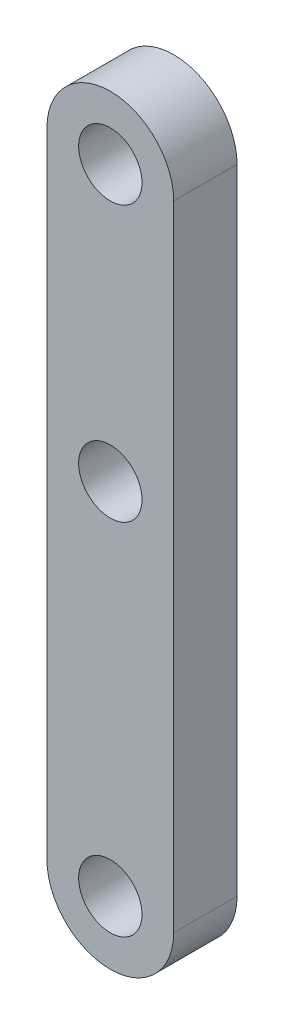
from build123d import *

# Parameters (mm, degrees)
SKETCH_1_R      = 1.5
EXTRUDE_1_DEPTH = 3


with BuildPart() as part:
    # ｽｹｯﾁ1 → ﾎﾞｽ - 押し出し1 (new body)
    with BuildSketch(Plane.XY):
        with BuildLine():
            Line((-3, 0), (-3, -30))
            ThreePointArc((-3, -30), (0, -33), (3, -30))
            Line((3, -30), (3, 0))
            ThreePointArc((3, 0), (0, 3), (-3, 0))
        make_face()
        Circle(SKETCH_1_R, mode=Mode.SUBTRACT)
        with Locations((0, -30)):
            Circle(SKETCH_1_R, mode=Mode.SUBTRACT)
        with Locations((0, -13)):
            Circle(SKETCH_1_R, mode=Mode.SUBTRACT)
    extrude(amount=EXTRUDE_1_DEPTH)


solid = part.part
